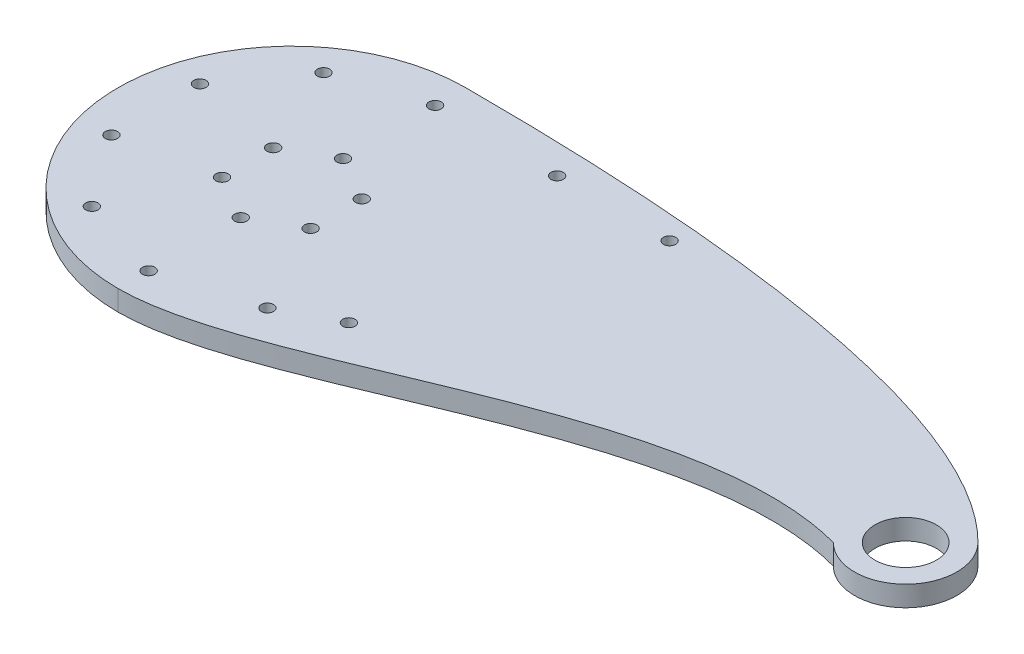
from build123d import *

# Parameters (mm, degrees)
BOSS_EXTRUDE3_OUTLINE_R = 7.5
BOSS_EXTRUDE3_DEPTH     = 5
SKETCH2_R               = 1.5
CUT_EXTRUDE1_DEPTH      = 10
SKETCH3_R               = 1.5
CUT_EXTRUDE2_DEPTH      = 10
SKETCH4_R               = 1.5
CUT_EXTRUDE3_DEPTH      = 10


# Read off the part's stored shape, not the designer's step: Boss-Extrude3
with BuildPart() as part:
    # Boss-Extrude3 outline → Boss-Extrude3 (new body)
    with BuildSketch(Plane(origin=(0, 0, 0), x_dir=(1, 0, 0), z_dir=(0, 1, 0))):
        with BuildLine():
            ThreePointArc((0, 42.5), (-42.5, 0), (0, -42.5))
            add(Edge.make_bspline(
                [(0, -42.5), (35.287909835, -42.5), (94.296573589, 3.71849472), (141.161165235, -8.838834765)],
                knots=[0, 0, 0, 0, 1, 1, 1, 1], degree=3))
            ThreePointArc((141.161165235, -8.838834765), (158.838834765, -8.838834765), (158.838834765, 8.838834765))
            add(Edge.make_bspline(
                [(0, 42.5), (43.860357416, 42.5), (128.226009794, 39.451659736), (158.838834765, 8.838834765)],
                knots=[0, 0, 0, 0, 1, 1, 1, 1], degree=3))
        make_face()
        with Locations((150, 0)):
            Circle(BOSS_EXTRUDE3_OUTLINE_R, mode=Mode.SUBTRACT)
    extrude(amount=BOSS_EXTRUDE3_DEPTH)

    # Sketch2 → Cut-Extrude1 (cut)
    with BuildSketch(Plane(origin=(0, 5, 0), x_dir=(1, 0, 0), z_dir=(0, 1, 0))):
        with Locations(Location((0, 35, 0), (0, 0, 270))):
            Circle(SKETCH2_R)
        with Locations(Location((0, 12.5, 0), (0, 0, 270))):
            Circle(SKETCH2_R)
        with Locations(Location((10.825317547, 6.25, 0), (0, 0, 270))):
            Circle(SKETCH2_R)
        with Locations(Location((10.825317547, -6.25, 0), (0, 0, 270))):
            Circle(SKETCH2_R)
        with Locations(Location((0, -12.5, 0), (0, 0, 270))):
            Circle(SKETCH2_R)
        with Locations(Location((-10.825317547, -6.25, 0), (0, 0, 270))):
            Circle(SKETCH2_R)
        with Locations(Location((-10.825317547, 6.25, 0), (0, 0, 270))):
            Circle(SKETCH2_R)
        with Locations(Location((-20.57248383, 28.315594803, 0), (0, 0, 270))):
            Circle(SKETCH2_R)
        with Locations(Location((-33.28697807, 10.815594803, 0), (0, 0, 270))):
            Circle(SKETCH2_R)
        with Locations(Location((-33.28697807, -10.815594803, 0), (0, 0, 270))):
            Circle(SKETCH2_R)
        with Locations(Location((-20.57248383, -28.315594803, 0), (0, 0, 270))):
            Circle(SKETCH2_R)
        with Locations(Location((0, -35, 0), (0, 0, 270))):
            Circle(SKETCH2_R)
    extrude(amount=-CUT_EXTRUDE1_DEPTH, mode=Mode.SUBTRACT)

    # Sketch3 → Cut-Extrude2 (cut)
    with BuildSketch(Plane(origin=(0, 5, 0), x_dir=(1, 0, 0), z_dir=(0, 1, 0))):
        with Locations(Location((29.822508304, 35, 0), (0, 0, 270))):
            Circle(SKETCH3_R)
        with Locations(Location((57.312909887, 35, 0), (0, 0, 270))):
            Circle(SKETCH3_R)
    extrude(amount=-CUT_EXTRUDE2_DEPTH, mode=Mode.SUBTRACT)

    # Sketch4 → Cut-Extrude3 (cut)
    with BuildSketch(Plane(origin=(0, 5, 0), x_dir=(1, 0, 0), z_dir=(0, 1, 0))):
        with Locations(Location((35.461413578, -21.530349116, 0), (0, 0, 270))):
            Circle(SKETCH4_R)
        with Locations(Location((22.392043347, -28.36049342, 0), (0, 0, 270))):
            Circle(SKETCH4_R)
    extrude(amount=-CUT_EXTRUDE3_DEPTH, mode=Mode.SUBTRACT)


solid = part.part
